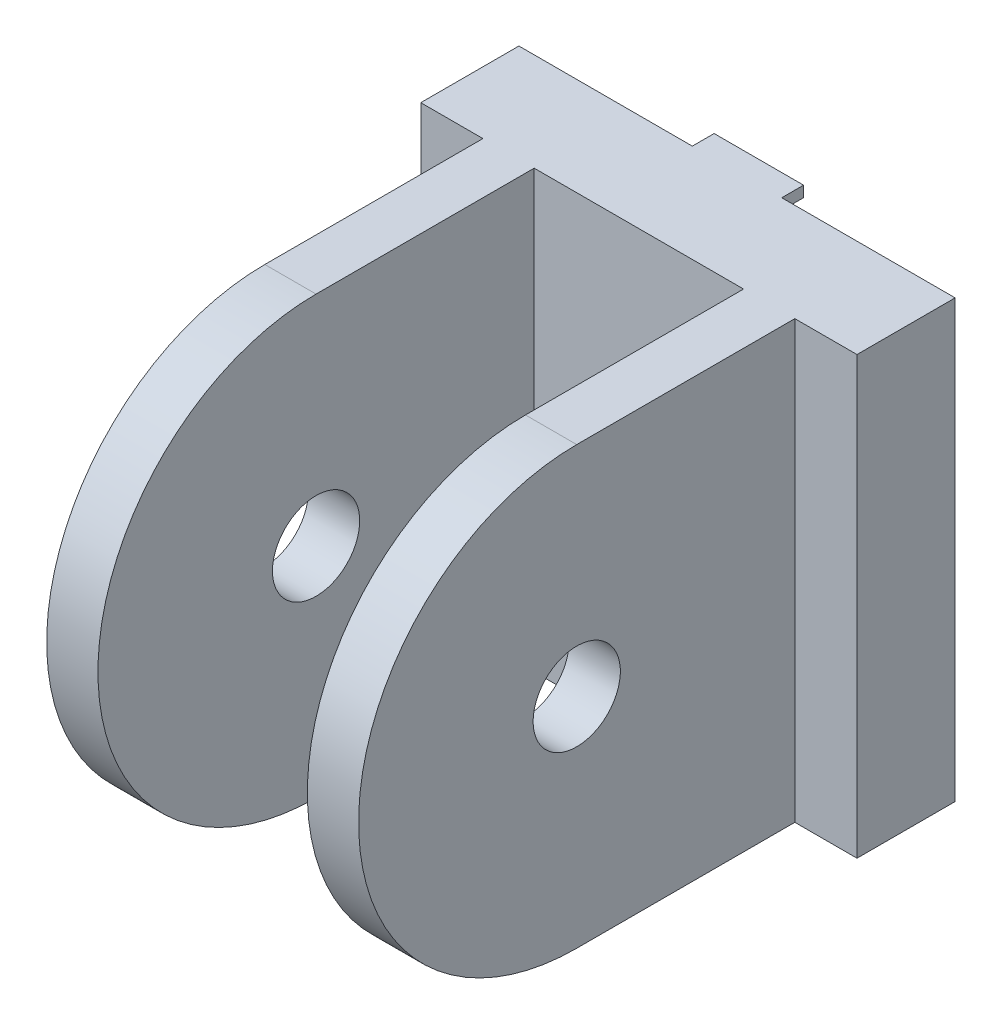
from build123d import *

# Parameters (mm, degrees)
SKETCH_1_W          = 40
SKETCH_1_H          = 40
EXTRUDE_1_DEPTH     = 9
SKETCH_2_W          = 4.7
SKETCH_2_H          = 40
EXTRUDE_2_DEPTH     = 40
CUT_EXTRUDE_START   = -28.6
CUT_EXTRUDE_2_DEPTH = 28.6
SKETCH_4_R          = 4
CUT_EXTRUDE_3_DEPTH = 64.067344958
SKETCH_6_R          = 4
CUT_EXTRUDE_5_DEPTH = 49.989794856
SKETCH_7_W          = 8.2
SKETCH_7_H          = 1
EXTRUDE_3_DEPTH     = 2


# Read off the part's stored shape, not the designer's step: 切除-拉伸2
with BuildPart() as part:
    # 草图1 → 凸台-拉伸1 (new body)
    with BuildSketch(Plane.XY):
        Rectangle(SKETCH_1_W, SKETCH_1_H)
    extrude(amount=EXTRUDE_1_DEPTH)

    # 草图2 → 凸台-拉伸2 (add)
    with BuildSketch(Plane.XY.offset(9)):
        with Locations((-11.95, 0)):
            Rectangle(SKETCH_2_W, SKETCH_2_H)
        with Locations((11.95, 0)):
            Rectangle(SKETCH_2_W, SKETCH_2_H)
    extrude(amount=EXTRUDE_2_DEPTH)

    # 切除-拉伸2 outline → 切除-拉伸2 (cut)
    with BuildSketch(Plane.ZY.offset(14.3).offset(CUT_EXTRUDE_START)):
        with BuildLine():
            Line((49, 20), (29, 20))
            ThreePointArc((29, 20), (43.142135559, 14.142135688), (49, 1.83e-07))
            Line((49, 1.83e-07), (49, 20))
        make_face()
        with BuildLine():
            Line((49, -20), (49, 1.83e-07))
            ThreePointArc((49, 1.83e-07), (43.142135688, -14.142135559), (29, -20))
            Line((29, -20), (49, -20))
        make_face()
    extrude(amount=CUT_EXTRUDE_2_DEPTH, mode=Mode.SUBTRACT)

    # 草图4 → 切除-拉伸3 (cut, through all)
    with BuildSketch(Plane.ZY.offset(14.3)):
        with Locations((29, 0)):
            Circle(SKETCH_4_R)
    extrude(amount=-CUT_EXTRUDE_3_DEPTH, mode=Mode.SUBTRACT)

    # 草图6 → 切除-拉伸5 (cut, through all)
    with BuildSketch(Plane.XY.offset(9)):
        Circle(SKETCH_6_R)
    extrude(amount=-CUT_EXTRUDE_5_DEPTH, mode=Mode.SUBTRACT)

    # 草图7 → 凸台-拉伸3 (add)
    with BuildSketch(Plane(origin=(0, 0, 0), x_dir=(-1, 0, 0), z_dir=(0, 0, -1))):
        with Locations((0, 19.5)):
            Rectangle(SKETCH_7_W, SKETCH_7_H)
        with Locations((0, -19.5)):
            Rectangle(SKETCH_7_W, SKETCH_7_H)
    extrude(amount=EXTRUDE_3_DEPTH)


solid = part.part
